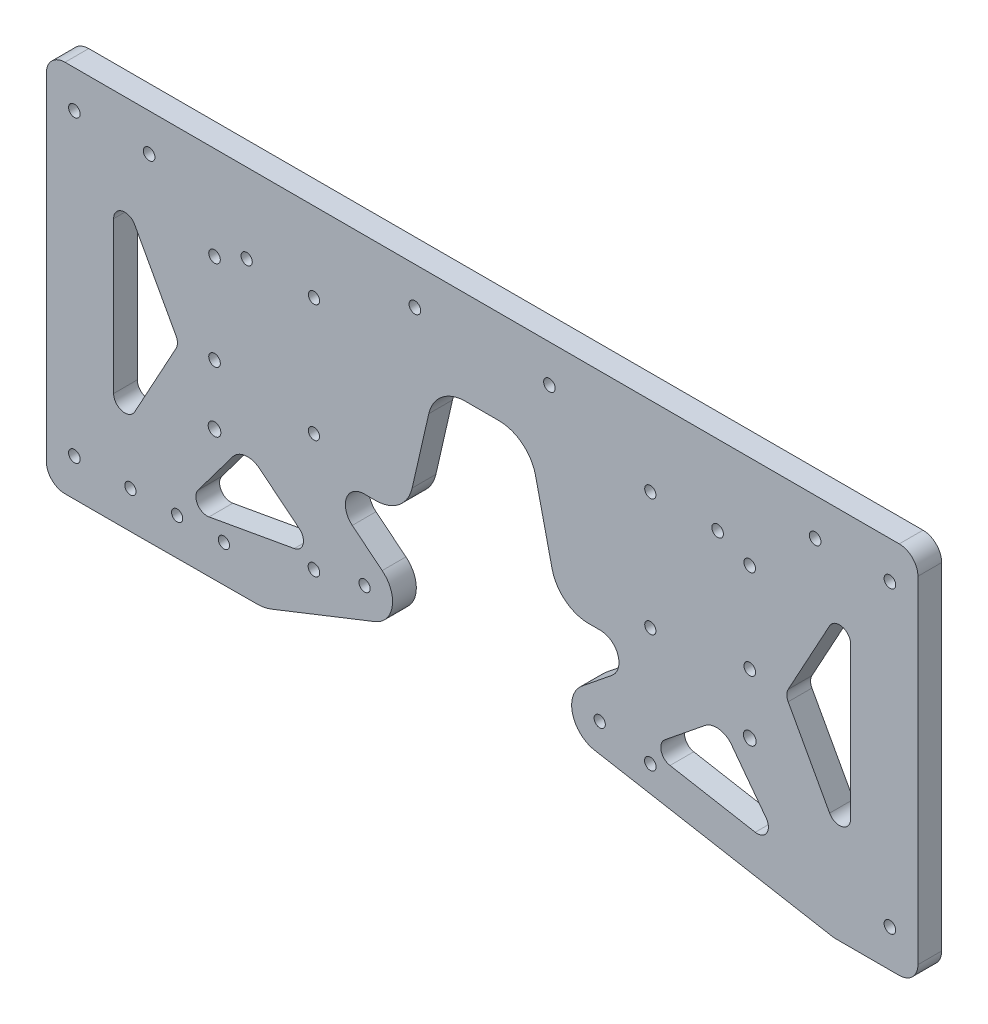
from build123d import *

# Parameters (mm, degrees)
SKETCH1_W           = 233.2
SKETCH1_H           = 100
SKETCH1_R           = 1.55
BOSS_EXTRUDE1_DEPTH = 6.35
FILLET1_R           = 5
SKETCH2_R           = 1.55
CUT_EXTRUDE1_DEPTH  = 6.35
SKETCH3_W           = 10
SKETCH3_H           = 12.7
BOSS_EXTRUDE2_DEPTH = 6.35
FILLET2_R           = 5
FILLET3_R           = 10
FILLET4_R           = 2
FILLET5_R           = 20
FILLET6_R           = 5
CUT_EXTRUDE2_DEPTH  = 10
SKETCH5_W           = 120
SKETCH5_H           = 40
CUT_EXTRUDE4_DEPTH  = 10
SKETCH6_R           = 1.5
CUT_EXTRUDE5_DEPTH  = 10
FILLET7_R           = 10
SKETCH7_W           = 25
SKETCH7_H           = 35
CUT_EXTRUDE6_DEPTH  = 10
FILLET9_R           = 10
SKETCH8_R           = 1.5
CUT_EXTRUDE7_DEPTH  = 10
BOSS_EXTRUDE3_START = -6.35
BOSS_EXTRUDE3_DEPTH = 6.35
FILLET10_R          = 5
BOSS_EXTRUDE4_START = -6.35
BOSS_EXTRUDE4_DEPTH = 6.35
FILLET11_R          = 3
FILLET12_R          = 3
CUT_EXTRUDE8_DEPTH  = 10
FILLET13_R          = 3
CUT_EXTRUDE9_DEPTH  = 10
SKETCH13_R          = 1.55
CUT_EXTRUDE10_DEPTH = 10
SKETCH14_R          = 1.5
CUT_EXTRUDE11_DEPTH = 10
BOSS_EXTRUDE5_START = -6.35
BOSS_EXTRUDE5_DEPTH = 6.35
FILLET14_R          = 10
SKETCH15_R          = 1.55
CUT_EXTRUDE12_DEPTH = 254.816001269
SCALE1_SCALE        = 0.333333333


# Read off the part's stored shape, not the designer's step: Boss-Extrude5
with BuildPart() as part:
    # Sketch1 → Boss-Extrude1 (new body)
    with BuildSketch(Plane.XY):
        with Locations((116.6, -50)):
            Rectangle(SKETCH1_W, SKETCH1_H)
        with Locations((7.5, -10)):
            Circle(SKETCH1_R, mode=Mode.SUBTRACT)
        with Locations((225.7, -10)):
            Circle(SKETCH1_R, mode=Mode.SUBTRACT)
        with Locations((7.5, -90)):
            Circle(SKETCH1_R, mode=Mode.SUBTRACT)
        with Locations((225.7, -90)):
            Circle(SKETCH1_R, mode=Mode.SUBTRACT)
        with Locations((27.5, -10)):
            Circle(SKETCH1_R, mode=Mode.SUBTRACT)
        with Locations((205.7, -10)):
            Circle(SKETCH1_R, mode=Mode.SUBTRACT)
        with Locations((134.6, -10)):
            Circle(SKETCH1_R, mode=Mode.SUBTRACT)
        with Locations((98.6, -10)):
            Circle(SKETCH1_R, mode=Mode.SUBTRACT)
    extrude(amount=BOSS_EXTRUDE1_DEPTH)

    # Fillet1
    fillet1_edges = [part.edges().sort_by_distance(p)[0] for p in [
        (233.2, -100, 3.175),
        (0, -100, 3.175),
        (0, 0, 3.175),
        (233.2, 0, 3.175),
    ]]
    fillet(fillet1_edges, radius=FILLET1_R)

    # Sketch2 → Cut-Extrude1 (cut)
    with BuildSketch(Plane.XY.offset(6.35)):
        with Locations((45, -25)):
            Circle(SKETCH2_R)
        with Locations((45, -49)):
            Circle(SKETCH2_R)
        with Locations(Location((188.2, -49, 0), (0, 0, 180))):
            Circle(SKETCH2_R)
        with Locations(Location((188.2, -25, 0), (0, 0, 180))):
            Circle(SKETCH2_R)
    extrude(amount=-CUT_EXTRUDE1_DEPTH, mode=Mode.SUBTRACT)

    # Sketch3 → Boss-Extrude2 (add)
    with BuildSketch(Plane.XY.offset(6.35)):
        with Locations((125.723568259, 6.35)):
            Rectangle(SKETCH3_W, SKETCH3_H)
        Polygon((120.723568259, 16.7), (120.723568259, 12.7), (130.723568259, 12.7), (130.723568259, 24.7), (85.723568259, 24.7), (85.723568259, 12.7), (95.723568259, 12.7), (95.723568259, 16.7), align=None)
        Polygon((130.723568259, 12.7), (130.723568259, 0), (152.313568259, 0), (130.723568259, 24.7), align=None)
    extrude(amount=-BOSS_EXTRUDE2_DEPTH)

    # Fillet2
    fillet2_edges = [part.edges().sort_by_distance(p)[0] for p in [
        (85.723568259, 12.7, 3.175),
    ]]
    fillet(fillet2_edges, radius=FILLET2_R)

    # Fillet3
    fillet3_edges = [part.edges().sort_by_distance(p)[0] for p in [
        (120.723568259, 0, 3.175),
    ]]
    fillet(fillet3_edges, radius=FILLET3_R)

    # Fillet4
    fillet4_edges = [part.edges().sort_by_distance(p)[0] for p in [
        (85.723568259, 24.7, 3.175),
    ]]
    fillet(fillet4_edges, radius=FILLET4_R)

    # Fillet5
    fillet5_edges = [part.edges().sort_by_distance(p)[0] for p in [
        (130.723568259, 24.7, 3.175),
        (152.313568259, 0, 3.175),
    ]]
    fillet(fillet5_edges, radius=FILLET5_R)

    # Fillet6
    fillet6_edges = [part.edges().sort_by_distance(p)[0] for p in [
        (120.723568259, 16.7, 3.175),
    ]]
    fillet(fillet6_edges, radius=FILLET6_R)

    # Sketch4 → Cut-Extrude2 (cut)
    with BuildSketch(Plane(origin=(0, 0, 0), x_dir=(-1, 0, 0), z_dir=(0, 0, -1))):
        with BuildLine():
            Line((-110.723568259, 0), (-161.395157905, 0))
            ThreePointArc((-161.395157905, 0), (-153.126132222, 1.789475179), (-146.33682816, 6.837678575))
            Line((-146.33682816, 6.837678575), (-136.700308357, 17.862321425))
            ThreePointArc((-136.700308357, 17.862321425), (-129.911004296, 22.910524821), (-121.641978613, 24.7))
            Line((-121.641978613, 24.7), (-87.723568259, 24.7))
            ThreePointArc((-87.723568259, 24.7), (-86.309354696, 24.114213562), (-85.723568259, 22.7))
            Line((-85.723568259, 22.7), (-85.723568259, 17.7))
            ThreePointArc((-85.723568259, 17.7), (-87.188034353, 14.164466094), (-90.723568259, 12.7))
            Line((-90.723568259, 12.7), (-95.723568259, 12.7))
            Line((-95.723568259, 12.7), (-95.723568259, 16.7))
            Line((-95.723568259, 16.7), (-115.723568259, 16.7))
            ThreePointArc((-115.723568259, 16.7), (-119.259102165, 15.235533906), (-120.723568259, 11.7))
            Line((-120.723568259, 11.7), (-120.723568259, 10))
            ThreePointArc((-120.723568259, 10), (-117.794636071, 2.928932188), (-110.723568259, 0))
        make_face()
    extrude(amount=-CUT_EXTRUDE2_DEPTH, mode=Mode.SUBTRACT)

    # Sketch5 → Cut-Extrude4 (cut)
    with BuildSketch(Plane.XY.offset(6.35)):
        Polygon((56.6, -100), (56.6, -60), (26.6, -100), align=None)
        with Locations((116.6, -80)):
            Rectangle(SKETCH5_W, SKETCH5_H)
        Polygon((206.6, -100), (176.6, -60), (176.6, -100), align=None)
    extrude(amount=-CUT_EXTRUDE4_DEPTH, mode=Mode.SUBTRACT)

    # Sketch6 → Cut-Extrude5 (cut)
    with BuildSketch(Plane.XY.offset(6.35)):
        with Locations((71.6, -21.25)):
            Circle(SKETCH6_R)
        with Locations((161.6, -21.25)):
            Circle(SKETCH6_R)
        with Locations((161.6, -52.75)):
            Circle(SKETCH6_R)
        with Locations((71.6, -52.75)):
            Circle(SKETCH6_R)
    extrude(amount=-CUT_EXTRUDE5_DEPTH, mode=Mode.SUBTRACT)

    # Fillet7
    fillet7_edges = [part.edges().sort_by_distance(p)[0] for p in [
        (206.6, -100, 3.175),
        (26.6, -100, 3.175),
        (56.6, -60, 3.175),
        (176.6, -60, 3.175),
    ]]
    fillet(fillet7_edges, radius=FILLET7_R)

    # Sketch7 → Cut-Extrude6 (cut)
    with BuildSketch(Plane.XY.offset(6.35)):
        Polygon((96.1, -60), (104.1, -60), (104.1, -25), align=None)
        Polygon((129.1, -25), (129.1, -60), (137.1, -60), align=None)
        with Locations((116.6, -42.5)):
            Rectangle(SKETCH7_W, SKETCH7_H)
    extrude(amount=-CUT_EXTRUDE6_DEPTH, mode=Mode.SUBTRACT)

    # Fillet9
    fillet9_edges = [part.edges().sort_by_distance(p)[0] for p in [
        (137.1, -60, 3.175),
        (96.1, -60, 3.175),
        (104.1, -25, 3.175),
        (129.1, -25, 3.175),
    ]]
    fillet(fillet9_edges, radius=FILLET9_R)

    # Sketch8 → Cut-Extrude7 (cut)
    with BuildSketch(Plane.XY.offset(6.35)):
        with Locations((53.6, -21.25)):
            Circle(SKETCH8_R)
    extrude(amount=-CUT_EXTRUDE7_DEPTH, mode=Mode.SUBTRACT)

    # Sketch9 → Boss-Extrude3 (add)
    with BuildSketch(Plane.XY.offset(6.35).offset(BOSS_EXTRUDE3_START)):
        with BuildLine():
            Line((53.6, -64), (52.97582451, -64.832233986))
            Line((52.97582451, -64.832233986), (80.428117061, -87.022837132))
            ThreePointArc((80.428117061, -87.022837132), (90.975638571, -85.904897064), (89.857698503, -75.357375554))
            Line((89.857698503, -75.357375554), (70.858883385, -60))
            Line((70.858883385, -60), (61.6, -60))
            ThreePointArc((61.6, -60), (57.127864045, -61.05572809), (53.6, -64))
        make_face()
        with BuildLine():
            ThreePointArc((83.976361625, -80.247148199), (85.642998156, -79.775924736), (86.642907782, -81.190106343))
            ThreePointArc((86.642907782, -81.190106343), (84.642817409, -82.60428795), (83.976361625, -80.247148199))
        make_face(mode=Mode.SUBTRACT)
    boss_extrude3 = extrude(amount=BOSS_EXTRUDE3_DEPTH)

    # Mirror1: Boss-Extrude3 across plane
    add(boss_extrude3.mirror(Plane.ZY.offset(-116.6)))

    # Fillet10
    fillet10_edges = [part.edges().sort_by_distance(p)[0] for p in [
        (52.97582451, -64.832233986, 3.175),
        (70.858883385, -60, 3.175),
        (180.22417549, -64.832233986, 3.175),
        (162.341116615, -60, 3.175),
    ]]
    fillet(fillet10_edges, radius=FILLET10_R)

    # Sketch10 → Boss-Extrude4 (add)
    with BuildSketch(Plane.XY.offset(6.35).offset(BOSS_EXTRUDE4_START)):
        with BuildLine():
            ThreePointArc((29.6, -96), (26.844092638, -98.514663376), (23.358283237, -99.844208453))
            Line((23.358283237, -99.844208453), (86.46162021, -88.573262682))
            ThreePointArc((86.46162021, -88.573262682), (83.276282006, -88.454107183), (80.428117061, -87.022837132))
            Line((80.428117061, -87.022837132), (72.798322589, -80.855419933))
            Line((72.798322589, -80.855419933), (36.033483436, -87.422022085))
            Line((36.033483436, -87.422022085), (29.6, -96))
        make_face()
    boss_extrude4 = extrude(amount=BOSS_EXTRUDE4_DEPTH)

    # Fillet11
    fillet11_edges = [part.edges().sort_by_distance(p)[0] for p in [
        (36.033483436, -87.422022085, 3.175),
        (72.798322589, -80.855419933, 3.175),
    ]]
    fillet(fillet11_edges, radius=FILLET11_R)

    # Mirror3: Boss-Extrude4 across plane
    add(boss_extrude4.mirror(Plane.ZY.offset(-116.6)))

    # Fillet12
    fillet12_edges = [part.edges().sort_by_distance(p)[0] for p in [
        (197.166516564, -87.422022085, 3.175),
        (160.401677411, -80.855419933, 3.175),
    ]]
    fillet(fillet12_edges, radius=FILLET12_R)

    # Sketch11 → Cut-Extrude8 (cut)
    with BuildSketch(Plane.XY.offset(6.35)):
        Polygon((35.5, -50), (18, -82), (18, -18), align=None)
        Polygon((215.2, -18), (215.2, -82), (197.7, -50), align=None)
    extrude(amount=-CUT_EXTRUDE8_DEPTH, mode=Mode.SUBTRACT)

    # Fillet13
    fillet13_edges = [part.edges().sort_by_distance(p)[0] for p in [
        (35.5, -50, 3.175),
        (18, -82, 3.175),
        (18, -18, 3.175),
        (215.2, -18, 3.175),
        (215.2, -82, 3.175),
        (197.7, -50, 3.175),
    ]]
    fillet(fillet13_edges, radius=FILLET13_R)

    # Sketch12 → Cut-Extrude9 (cut)
    with BuildSketch(Plane.XY.offset(6.35)):
        with BuildLine():
            ThreePointArc((186.5, -65), (188.2, -66.7), (189.9, -65))
            ThreePointArc((189.9, -65), (188.2, -63.3), (186.5, -65))
        make_face()
        with BuildLine():
            ThreePointArc((43.3, -65), (45, -66.7), (46.7, -65))
            ThreePointArc((46.7, -65), (45, -63.3), (43.3, -65))
        make_face()
    extrude(amount=-CUT_EXTRUDE9_DEPTH, mode=Mode.SUBTRACT)

    # Sketch13 → Cut-Extrude10 (cut)
    with BuildSketch(Plane.XY.offset(6.35)):
        with Locations((161.599999999, -84.25)):
            Circle(SKETCH13_R)
        with Locations((71.6, -84.25)):
            Circle(SKETCH13_R)
    extrude(amount=-CUT_EXTRUDE10_DEPTH, mode=Mode.SUBTRACT)

    # Sketch14 → Cut-Extrude11 (cut)
    with BuildSketch(Plane(origin=(0, 0, 0), x_dir=(-1, 0, 0), z_dir=(0, 0, -1))):
        with Locations((-22.5, -90)):
            Circle(SKETCH14_R)
        with Locations((-35, -90)):
            Circle(SKETCH14_R)
        with Locations((-47.5, -90)):
            Circle(SKETCH14_R)
    extrude(amount=-CUT_EXTRUDE11_DEPTH, mode=Mode.SUBTRACT)

    # Boss-Extrude5 outline → Boss-Extrude5 (add)
    with BuildSketch(Plane(origin=(0, 0, 0), x_dir=(-1, 0, 0), z_dir=(0, 0, -1)).offset(BOSS_EXTRUDE5_START)):
        with BuildLine():
            Line((-87.900343264, -88.164814191), (-58.358283237, -99.844208453))
            Line((-58.358283237, -99.844208453), (-21.684763887, -99.999640748))
            ThreePointArc((-21.684763887, -99.999640748), (-22.524794828, -99.957145902), (-23.358283237, -99.844208453))
            Line((-23.358283237, -99.844208453), (-86.46162021, -88.573262682))
            ThreePointArc((-86.46162021, -88.573262682), (-87.191188278, -88.404990057), (-87.900343264, -88.164814191))
        make_face()
    extrude(amount=BOSS_EXTRUDE5_DEPTH)

    # Fillet14
    fillet14_edges = [part.edges().sort_by_distance(p)[0] for p in [
        (58.358283237, -99.844208453, 3.175),
    ]]
    fillet(fillet14_edges, radius=FILLET14_R)

    # Sketch15 → Cut-Extrude12 (cut, through all)
    with BuildSketch(Plane(origin=(0, 0, 0), x_dir=(-1, 0, 0), z_dir=(0, 0, -1))):
        with Locations((-179.6, -21.25)):
            Circle(SKETCH15_R)
    extrude(amount=-CUT_EXTRUDE12_DEPTH, mode=Mode.SUBTRACT)


with BuildPart() as part_1:
    # Scale1: scaled about (115.992000253, -43.884971814, 3.175)
    add(part.part.scale(SCALE1_SCALE).moved(Location((77.328000169, -29.256647876, 2.116666667))))


solid = part_1.part
